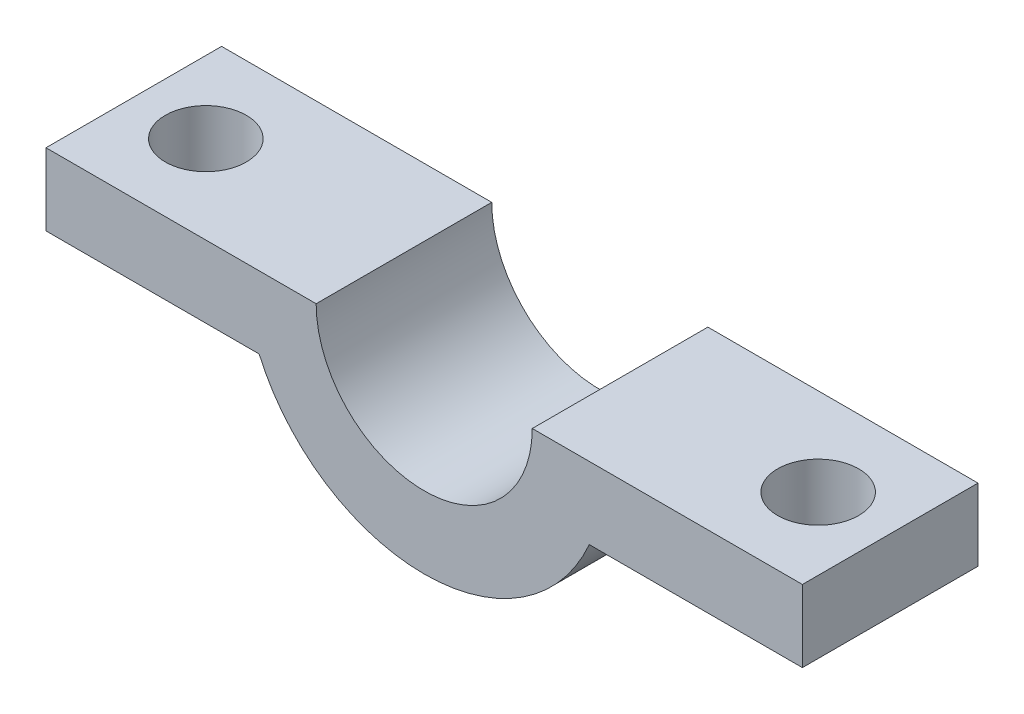
from build123d import *

# Parameters (mm, degrees)
EXTRUDE_THIN1_DEPTH = 9.75
SKETCH3_W           = 15
SKETCH3_H           = 9.75
BOSS_EXTRUDE1_DEPTH = 4
SKETCH4_R           = 2.25
CUT_EXTRUDE1_DEPTH  = 26.220279538


with BuildPart() as part:
    # Sketch1 → Extrude-Thin1 (new body)
    with BuildSketch(Plane.XY):
        with BuildLine():
            ThreePointArc((-6, 0), (0, -6), (6, 0))
            Line((6, 0), (10, 0))
            ThreePointArc((10, 0), (0, -10), (-10, 0))
            Line((-10, 0), (-6, 0))
        make_face()
    extrude(amount=EXTRUDE_THIN1_DEPTH)

    # Sketch3 → Boss-Extrude1 (add)
    with BuildSketch(Plane(origin=(0, 0, 0), x_dir=(1, 0, 0), z_dir=(0, 1, 0))):
        with Locations((-13.5, -4.875)):
            Rectangle(SKETCH3_W, SKETCH3_H)
        with Locations((13.5, -4.875)):
            Rectangle(SKETCH3_W, SKETCH3_H)
    extrude(amount=-BOSS_EXTRUDE1_DEPTH)

    # Sketch4 → Cut-Extrude1 (cut, through all)
    with BuildSketch(Plane(origin=(0, 0, 0), x_dir=(1, 0, 0), z_dir=(0, 1, 0))):
        with Locations((-17, -4.875)):
            Circle(SKETCH4_R)
        with Locations((17, -4.875)):
            Circle(SKETCH4_R)
    extrude(amount=-CUT_EXTRUDE1_DEPTH, mode=Mode.SUBTRACT)


solid = part.part
